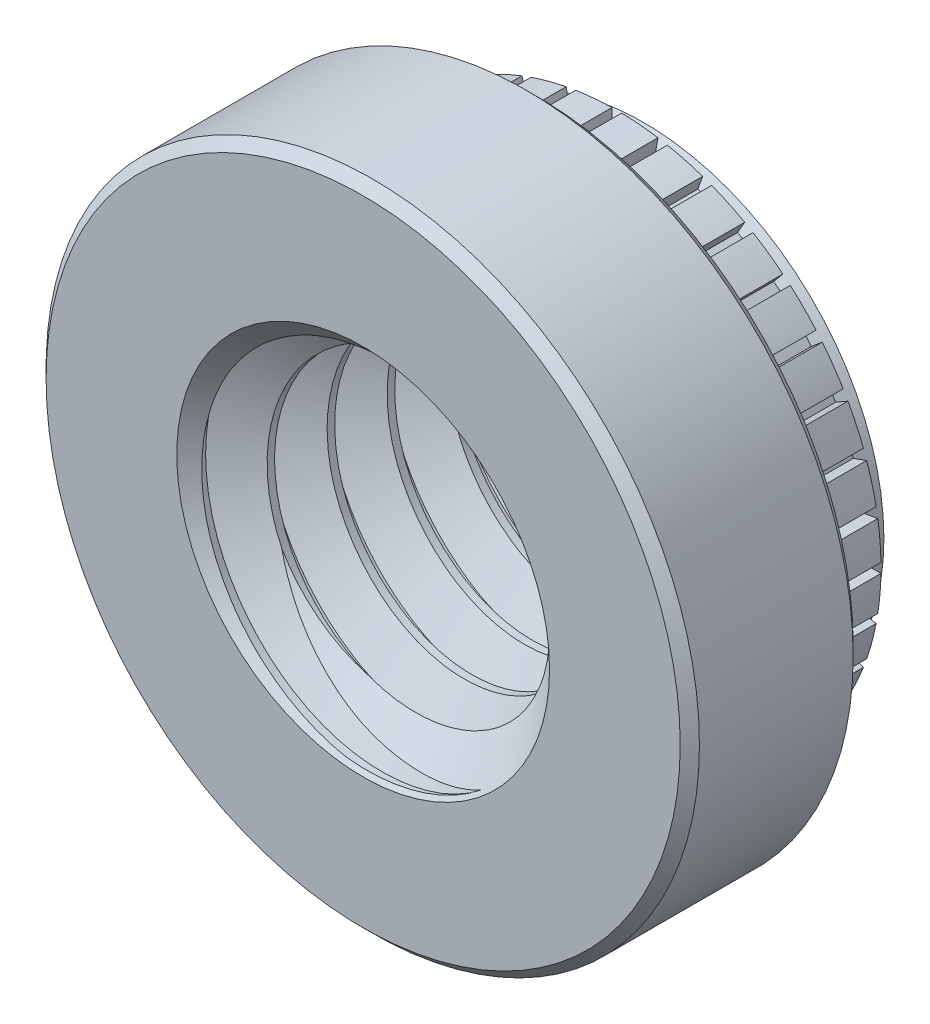
from build123d import *

# Parameters (mm, degrees)
SKETCH1_R               = 4.318
EXTRUDE1_DEPTH          = 2.286
SKETCH2_R               = 3.4925
EXTRUDE2_DEPTH          = 1.4224
SKETCH3_W               = 0.127
SKETCH3_H               = 1.016
CUT_EXTRUDE_THIN1_DEPTH = 1.4224
CIRPATTERN1_COUNT       = 36
SKETCH5_OUTSIDE_W       = 13.448
SKETCH5_OUTSIDE_H       = 13.448
SKETCH5_OUTSIDE_R       = 3.175
CUT_EXTRUDE1_DEPTH      = 0.3556
CUT_EXTRUDE1_DRAFT      = 20
CHAMFER2_SIZE           = 0.127
SKETCH7_R               = 2.413
CUT_EXTRUDE3_DEPTH      = 8.144401904
SWEEP1_PITCH            = 0.79375
SKETCH10_R              = 4.318
CUT_EXTRUDE4_DEPTH      = 8.528451217
SKETCH11_R              = 3.175
CUT_EXTRUDE5_DEPTH      = 8.144401955


with BuildPart() as part:
    # Sketch1 → Extrude1 (new body)
    with BuildSketch(Plane.XY):
        Circle(SKETCH1_R)
    extrude(amount=-EXTRUDE1_DEPTH)

    # Sketch2 → Extrude2 (add)
    with BuildSketch(Plane(origin=(0, 0, -2.286), x_dir=(-1, 0, 0), z_dir=(0, 0, -1))):
        with Locations(Location((0, 0, 0), (0, 0, 180))):
            Circle(SKETCH2_R)
    extrude(amount=EXTRUDE2_DEPTH)

    # Sketch3 → Cut-Extrude-Thin1 (cut)
    with BuildSketch(Plane(origin=(0, 0, -3.7084), x_dir=(-1, 0, 0), z_dir=(0, 0, -1))):
        with Locations((0, 3.81)):
            Rectangle(SKETCH3_W, SKETCH3_H)
    cut_extrude_thin1 = extrude(amount=-CUT_EXTRUDE_THIN1_DEPTH, mode=Mode.SUBTRACT)

    # CirPattern1: Cut-Extrude-Thin1 ×36 about axis
    cirpattern1_axis = Axis((0, 0, 0), (0, 0, 1))
    for i in range(1, CIRPATTERN1_COUNT):
        add(cut_extrude_thin1.rotate(cirpattern1_axis, i * 360 / CIRPATTERN1_COUNT), mode=Mode.SUBTRACT)


with BuildPart() as cut_extrude1_tool:
    # Sketch5 outside → Cut-Extrude1 (with draft: the straight prism first)
    with BuildSketch(Plane(origin=(0, 0, -3.7084), x_dir=(-1, 0, 0), z_dir=(0, 0, -1))):
        Rectangle(SKETCH5_OUTSIDE_W, SKETCH5_OUTSIDE_H)
        Circle(SKETCH5_OUTSIDE_R, mode=Mode.SUBTRACT)
    extrude(amount=-CUT_EXTRUDE1_DEPTH)
    # Cut-Extrude1: the draft: its side faces are tilted about the plane it starts from
    cut_extrude1_sides = [cut_extrude1_tool.faces().sort_by_distance(p)[0] for p in [
        (0, -6.724, -3.5306),
        (-6.724, 0, -3.5306),
        (0, 6.724, -3.5306),
        (6.724, 0, -3.5306),
        (3.175, 0, -3.5306),
    ]]
    draft(cut_extrude1_sides, Plane(origin=(0, 0, -3.7084), x_dir=(-1, 0, 0), z_dir=(0, 0, -1)), CUT_EXTRUDE1_DRAFT)


with BuildPart() as part_1:
    add(part.part)

    # Cut-Extrude1: cut by cut_extrude1_tool
    add(cut_extrude1_tool.part, mode=Mode.SUBTRACT)

    # Chamfer2
    chamfer2_edges = [part_1.edges().sort_by_distance(p)[0] for p in [
        (-4.318, 0, 0),
        (-4.318, 0, -2.286),
    ]]
    chamfer(chamfer2_edges, length=CHAMFER2_SIZE)

    # Sketch7 → Cut-Extrude3 (cut, through all)
    with BuildSketch(Plane.XY):
        Circle(SKETCH7_R)
    extrude(amount=-CUT_EXTRUDE3_DEPTH, mode=Mode.SUBTRACT)

    # Sweep1: the profile of Sketch9 profile screwed along a right-hand helix of 8.672 turns, 6 arcs to a turn; built about Z, then put on its axis
    sweep1_z = Axis((0, 0, 0), (0, 0, 1))
    sweep1_corners = [(2.4133, 0, -0.694704455), (1.897444252, 0, -0.396875), (1.897444252, 0, -0.29765625), (2.4133, 0, 0.000173205)]
    with BuildLine(mode=Mode.PRIVATE) as sweep1_profile:
        Line(sweep1_corners[0], sweep1_corners[1])
        Line(sweep1_corners[1], sweep1_corners[2])
        Line(sweep1_corners[2], sweep1_corners[3])
        Line(sweep1_corners[3], sweep1_corners[0])
    sweep1_cap = Face(sweep1_profile.wire())
    sweep1_turn_angles = [0, 30, 60, 90, 120, 150, 180, 210, 240, 270, 300, 330, 360]
    sweep1_turn_weights = [1, 0.8660254037844387, 1, 0.8660254037844387, 1, 0.8660254037844387, 1, 0.8660254037844387, 1, 0.8660254037844387, 1, 0.8660254037844387, 1]
    sweep1_turn_rails = [Edge.make_bspline([Vector(p[0], p[1], 0).rotate(sweep1_z, sweep1_turn_angles[k]) / sweep1_turn_weights[k] + Vector(0, 0, p[2] + SWEEP1_PITCH * sweep1_turn_angles[k] / 360) for k in range(13)], [0, 0, 0, 1, 1, 2, 2, 3, 3, 4, 4, 5, 5, 6, 6, 6], 2, sweep1_turn_weights) for p in sweep1_corners]
    sweep1_turn_sides = [Face.make_surface_from_curves(sweep1_turn_rails[p[0]], sweep1_turn_rails[p[1]]) for p in [(0, 1), (1, 2), (2, 3), (3, 0)]]
    sweep1_last_angles = [2880, 2910, 2940, 2970, 3000, 3030, 3060, 3090, 3120, 3120.96, 3121.92]
    sweep1_last_weights = [1, 0.8660254037844387, 1, 0.8660254037844387, 1, 0.8660254037844387, 1, 0.8660254037844387, 1, 0.999859635576779, 1]
    sweep1_last_rails = [Edge.make_bspline([Vector(p[0], p[1], 0).rotate(sweep1_z, sweep1_last_angles[k]) / sweep1_last_weights[k] + Vector(0, 0, p[2] + SWEEP1_PITCH * sweep1_last_angles[k] / 360) for k in range(11)], [0, 0, 0, 1, 1, 2, 2, 3, 3, 4, 4, 5, 5, 5], 2, sweep1_last_weights) for p in sweep1_corners]
    sweep1_last_sides = [Face.make_surface_from_curves(sweep1_last_rails[p[0]], sweep1_last_rails[p[1]]) for p in [(0, 1), (1, 2), (2, 3), (3, 0)]]
    sweep1 = Plane(origin=(0, 0, -3.7084), x_dir=(0, 1, 0), z_dir=(0, 0, 1)) * Solid(Shell([*[p.moved(Location((0, 0, SWEEP1_PITCH * i))) for i in range(8) for p in sweep1_turn_sides], *sweep1_last_sides, sweep1_cap, sweep1_cap.rotate(sweep1_z, 3121.92).moved(Location((0, 0, SWEEP1_PITCH * 3121.92 / 360)))]))
    add(sweep1)

    # Sketch10 → Cut-Extrude4 (cut, through all)
    with BuildSketch(Plane.XY):
        Circle(SKETCH10_R)
    extrude(amount=CUT_EXTRUDE4_DEPTH, mode=Mode.SUBTRACT)

    # Sketch11 → Cut-Extrude5 (cut, through all)
    with BuildSketch(Plane(origin=(0, 0, -3.7084), x_dir=(-1, 0, 0), z_dir=(0, 0, -1))):
        Circle(SKETCH11_R)
    extrude(amount=CUT_EXTRUDE5_DEPTH, mode=Mode.SUBTRACT)

    # Cut-Extrude6 cone 1 section (through the dimple's axis) → Cut-Extrude6 (revolve, cut)
    with BuildSketch(Plane(origin=(0, 0, 0), x_dir=(0, -1, 0), z_dir=(1, 0, 0))):
        Polygon((0, 0), (2.4638, 0), (0, 2.4638), align=None)
    revolve(axis=Axis((0, 0, 0), (0, 0, -1)), mode=Mode.SUBTRACT)

    # Cut-Extrude7 cone 1 section (through the dimple's axis) → Cut-Extrude7 (revolve, cut)
    with BuildSketch(Plane(origin=(0, 0, -3.7084), x_dir=(0, 1, 0), z_dir=(1, 0, 0))):
        Polygon((0, 0), (2.4638, 0), (0, 2.4638), align=None)
    revolve(axis=Axis((0, 0, -3.7084), (0, 0, 1)), mode=Mode.SUBTRACT)


solid = part_1.part
